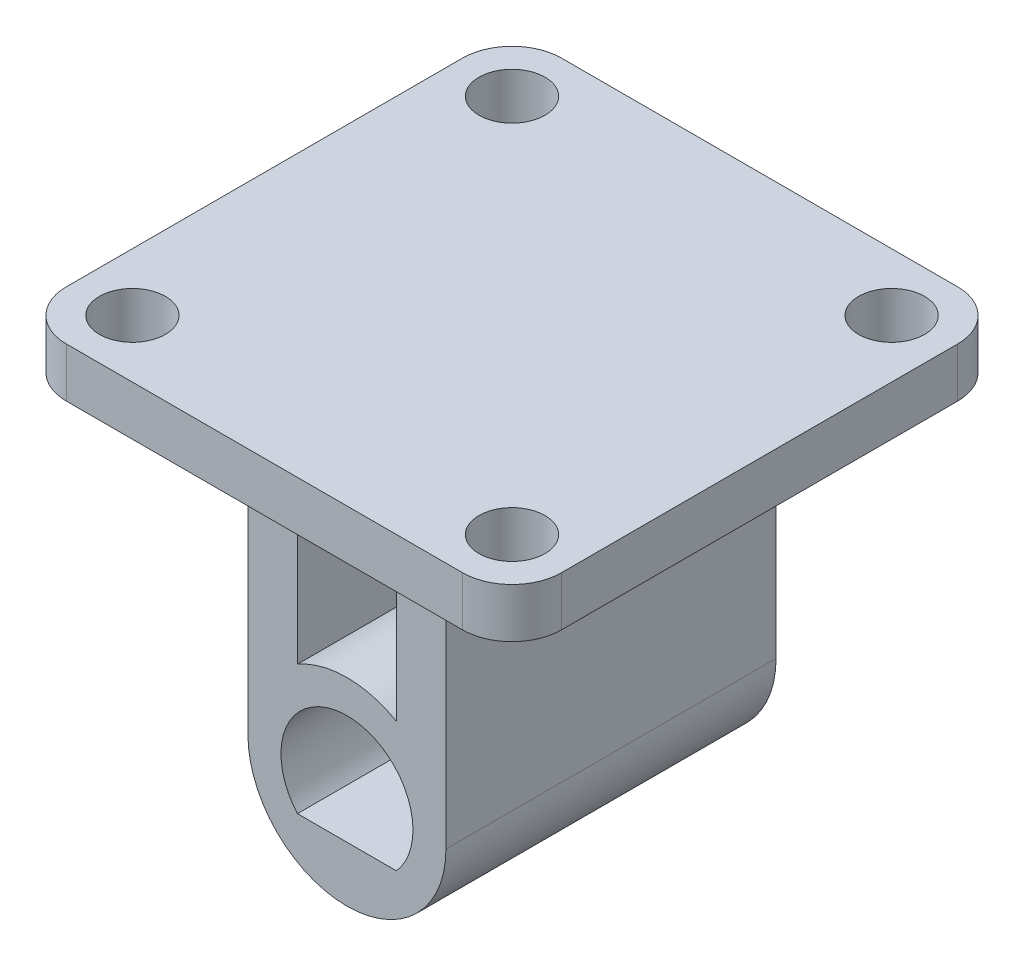
from build123d import *
from build123d.topology import SkipClean

# Parameters (mm, degrees)
CROQUIS1_W              = 30
CROQUIS1_H              = 30
SALIENTE_EXTRUIR1_DEPTH = 3
SALIENTE_EXTRUIR2_DEPTH = 20
CROQUIS4_R              = 2
CORTAR_EXTRUIR1_DEPTH   = 34.555923471
REDONDEO2_R             = 3
REDONDEO4_R             = 2
REDONDEO5_START         = -6
REDONDEO5_DEPTH         = 3
REDONDEO5_START_2       = 3
REDONDEO5_2_DEPTH       = 3
REDONDEO5_START_3       = -13.0000001
REDONDEO5_3_DEPTH       = 26.0000001
REDONDEO5_START_4       = -10
REDONDEO5_4_DEPTH       = 20


with BuildPart() as part:
    # Croquis1 → Saliente-Extruir1 (new body)
    with BuildSketch(Plane(origin=(0, 0, 0), x_dir=(1, 0, 0), z_dir=(0, 1, 0))):
        Rectangle(CROQUIS1_W, CROQUIS1_H)
    extrude(amount=SALIENTE_EXTRUIR1_DEPTH)

    # Croquis3 → Saliente-Extruir2 (add)
    with BuildSketch(Plane.XY.offset(10)):
        with BuildLine():
            Line((-3, 0), (-3, -11.803847577))
            ThreePointArc((-3, -11.803847577), (0, -11), (3, -11.803847577))
            Line((3, -11.803847577), (3, 0))
            Line((3, 0), (6, 0))
            Line((6, 0), (6, -17))
            ThreePointArc((6, -17), (0, -23), (-6, -17))
            Line((-6, -17), (-6, 0))
            Line((-6, 0), (-3, 0))
        make_face()
        with BuildLine():
            Line((-3, -19.645751311), (3, -19.645751311))
            ThreePointArc((3, -19.645751311), (0, -13), (-3, -19.645751311))
        make_face(mode=Mode.SUBTRACT)
    extrude(amount=-SALIENTE_EXTRUIR2_DEPTH)

    # Croquis4 → Cortar-Extruir1 (cut, through all)
    with BuildSketch(Plane(origin=(0, 3, 0), x_dir=(1, 0, 0), z_dir=(0, 1, 0))):
        with Locations(Location((-11.5, 11.5, 0), (0, 0, 270))):
            Circle(CROQUIS4_R)
        with Locations(Location((11.5, 11.5, 0), (0, 0, 270))):
            Circle(CROQUIS4_R)
        with Locations(Location((11.5, -11.5, 0), (0, 0, 270))):
            Circle(CROQUIS4_R)
        with Locations(Location((-11.5, -11.5, 0), (0, 0, 270))):
            Circle(CROQUIS4_R)
    extrude(amount=-CORTAR_EXTRUIR1_DEPTH, mode=Mode.SUBTRACT)

    # Redondeo2
    redondeo2_edges = [part.edges().sort_by_distance(p)[0] for p in [
        (-15, 1.5, -15),
        (15, 1.5, -15),
        (15, 1.5, 15),
        (-15, 1.5, 15),
    ]]
    fillet(redondeo2_edges, radius=REDONDEO2_R)

    # Redondeo4
    redondeo4_edges = [part.edges().sort_by_distance(p)[0] for p in [
        (-3, 0, 0),
        (3, 0, 0),
    ]]
    fillet(redondeo4_edges, radius=REDONDEO4_R)

    # Redondeo5: read off the stored shape, not the designer's step
    # Redondeo5 outline → Redondeo5 (add)
    with BuildSketch(Plane.YZ.offset(REDONDEO5_START)):
        with BuildLine():
            Line((0, -13), (0, -10))
            Line((0, -10), (-3, -10))
            ThreePointArc((-3, -10), (-0.878679656, -10.878679656), (0, -13))
        make_face()
        with BuildLine():
            ThreePointArc((0, 13), (-0.878679656, 10.878679656), (-3, 10))
            Line((-3, 10), (0, 10))
            Line((0, 10), (0, 13))
        make_face()
    extrude(amount=REDONDEO5_DEPTH)

    # Redondeo5 2 outline → Redondeo5 2 (add)
    with BuildSketch(Plane.YZ.offset(REDONDEO5_START_2)):
        with BuildLine():
            Line((0, -13), (0, -10))
            Line((0, -10), (-3, -10))
            ThreePointArc((-3, -10), (-0.878679656, -10.878679656), (0, -13))
        make_face()
        with BuildLine():
            ThreePointArc((0, 13), (-0.878679656, 10.878679656), (-3, 10))
            Line((-3, 10), (0, 10))
            Line((0, 10), (0, 13))
        make_face()
    extrude(amount=REDONDEO5_2_DEPTH)

    # Redondeo5 3 outline → Redondeo5 3 (add)
    with SkipClean():  # the faces are left unmerged after this step: merging them gives an invalid solid
        with BuildSketch(Plane.XY.offset(REDONDEO5_START_3)):
            with BuildLine():
                Line((-3, 0), (-3, -2))
                ThreePointArc((-3, -2), (-2.414213562, -0.585786438), (-1, 0))
                Line((-1, 0), (-3, 0))
            make_face()
            with BuildLine():
                Line((-6, -3), (-6, 0))
                Line((-6, 0), (-9, 0))
                ThreePointArc((-9, 0), (-6.878679656, -0.878679656), (-6, -3))
            make_face()
            with BuildLine():
                Line((9, 0), (6, 0))
                Line((6, 0), (6, -3))
                ThreePointArc((6, -3), (6.878679656, -0.878679656), (9, 0))
            make_face()
            with BuildLine():
                Line((3, 0), (1, 0))
                ThreePointArc((1, 0), (2.414213562, -0.585786438), (3, -2))
                Line((3, -2), (3, 0))
            make_face()
        extrude(amount=REDONDEO5_3_DEPTH)

    # Redondeo5 4 outline → Redondeo5 4 (cut)
    with SkipClean():  # the faces are left unmerged after this step: merging them gives an invalid solid
        with BuildSketch(Plane.YZ.offset(REDONDEO5_START_4)):
            with BuildLine():
                ThreePointArc((0, -13.00000005), (-0.878679638, -10.878679674), (-3, -10))
                Line((-3, -10), (-3, -13.0000001))
                Line((-3, -13.0000001), (0, -13.00000005))
            make_face()
            with BuildLine():
                Line((0, 13), (-3, 13))
                Line((-3, 13), (-3, 10))
                ThreePointArc((-3, 10), (-0.878679656, 10.878679656), (0, 13))
            make_face()
        extrude(amount=REDONDEO5_4_DEPTH, mode=Mode.SUBTRACT)


solid = part.part
